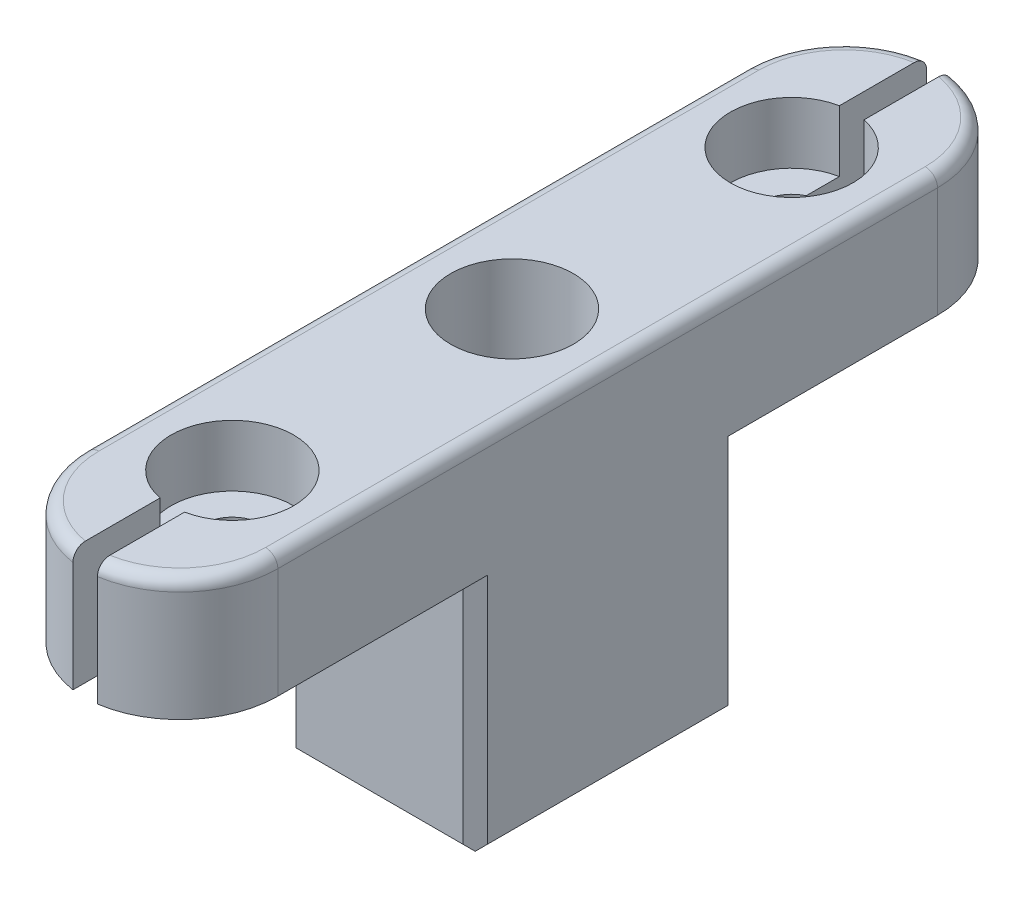
from build123d import *

# Parameters (mm, degrees)
ESQUISSE1_W             = 7.8
ESQUISSE1_H             = 10.8
BOSS_EXTRU_1_DEPTH      = 15
ESQUISSE6_R             = 1.05
ENL_V_MAT_EXTRU_2_DEPTH = 21.061904197
ENL_V_MAT_EXTRU_3_DEPTH = 2
ESQUISSE8_R             = 2.5
ENL_V_MAT_EXTRU_4_DEPTH = 11
ESQUISSE9_W             = 7.8
ESQUISSE9_H             = 5
BOSS_EXTRU_2_DEPTH      = 12
ESQUISSE10_W            = 7.8
ESQUISSE10_H            = 5
BOSS_EXTRU_3_DEPTH      = 12
ESQUISSE11_R            = 1.2
ENL_V_MAT_EXTRU_5_DEPTH = 27.089844768
ESQUISSE15_W            = 1
ESQUISSE15_H            = 4.909128789
ENL_V_MAT_EXTRU_6_DEPTH = 29.384502814
ESQUISSE16_R            = 2.5
ENL_V_MAT_EXTRU_7_DEPTH = 2.5
ESQUISSE17_W            = 1
ESQUISSE17_H            = 4.91
ENL_V_MAT_EXTRU_8_DEPTH = 10
CONG_3_R                = 4
CHANFREIN1_SIZE         = 0.5
CHANFREIN2_SIZE         = 0.5
CONG_5_R                = 0.5


with BuildPart() as part:
    # Esquisse1 → Boss.-Extru.1 (new body)
    with BuildSketch(Plane(origin=(0, 0, 0), x_dir=(1, 0, 0), z_dir=(0, 1, 0))):
        with Locations((3.9, 5.4)):
            Rectangle(ESQUISSE1_W, ESQUISSE1_H)
    extrude(amount=BOSS_EXTRU_1_DEPTH)

    # Esquisse6 → Enlèv. mat.-Extru.2 (cut, through all)
    with BuildSketch(Plane.XZ):
        with Locations(Location((3.9, -5.4, 0), (0, 0, 270))):
            Circle(ESQUISSE6_R)
    extrude(amount=-ENL_V_MAT_EXTRU_2_DEPTH, mode=Mode.SUBTRACT)

    # Esquisse7 → Enlèv. mat.-Extru.3 (cut)
    with BuildSketch(Plane.XZ):
        Polygon((3.9, -7.68), (5.874537921, -6.54), (5.874537921, -4.26), (3.9, -3.12), (1.925462079, -4.26), (1.925462079, -6.54), align=None)
    extrude(amount=-ENL_V_MAT_EXTRU_3_DEPTH, mode=Mode.SUBTRACT)

    # Esquisse8 → Enlèv. mat.-Extru.4 (cut)
    with BuildSketch(Plane(origin=(0, 15, 0), x_dir=(1, 0, 0), z_dir=(0, 1, 0))):
        with Locations(Location((3.9, 5.4, 0), (0, 0, 270))):
            Circle(ESQUISSE8_R)
    extrude(amount=-ENL_V_MAT_EXTRU_4_DEPTH, mode=Mode.SUBTRACT)

    # Esquisse9 → Boss.-Extru.2 (add)
    with BuildSketch(Plane(origin=(0, 0, -10.8), x_dir=(-1, 0, 0), z_dir=(0, 0, -1))):
        with Locations((-3.9, 12.5)):
            Rectangle(ESQUISSE9_W, ESQUISSE9_H)
    extrude(amount=BOSS_EXTRU_2_DEPTH)

    # Esquisse10 → Boss.-Extru.3 (add)
    with BuildSketch(Plane.XY):
        with Locations((3.9, 12.5)):
            Rectangle(ESQUISSE10_W, ESQUISSE10_H)
    extrude(amount=BOSS_EXTRU_3_DEPTH)

    # Esquisse11 → Enlèv. mat.-Extru.5 (cut, through all)
    with BuildSketch(Plane.XZ.offset(-10)):
        with Locations(Location((3.9, -16.8, 0), (0, 0, 270))):
            Circle(ESQUISSE11_R)
        with Locations(Location((3.9, 6, 0), (0, 0, 270))):
            Circle(ESQUISSE11_R)
    extrude(amount=-ENL_V_MAT_EXTRU_5_DEPTH, mode=Mode.SUBTRACT)

    # Esquisse15 → Enlèv. mat.-Extru.6 (cut, through all)
    with BuildSketch(Plane(origin=(0, 15, 0), x_dir=(1, 0, 0), z_dir=(0, 1, 0))):
        with Locations((3.9, -9.545435605)):
            Rectangle(ESQUISSE15_W, ESQUISSE15_H)
    extrude(amount=-ENL_V_MAT_EXTRU_6_DEPTH, mode=Mode.SUBTRACT)

    # Esquisse16 → Enlèv. mat.-Extru.7 (cut)
    with BuildSketch(Plane(origin=(0, 15, 0), x_dir=(1, 0, 0), z_dir=(0, 1, 0))):
        with Locations(Location((3.9, 16.8, 0), (0, 0, 270))):
            Circle(ESQUISSE16_R)
        with Locations((3.9, -6)):
            Circle(ESQUISSE16_R)
    extrude(amount=-ENL_V_MAT_EXTRU_7_DEPTH, mode=Mode.SUBTRACT)

    # Esquisse17 → Enlèv. mat.-Extru.8 (cut)
    with BuildSketch(Plane(origin=(0, 15, 0), x_dir=(1, 0, 0), z_dir=(0, 1, 0))):
        with Locations((3.9, 20.345)):
            Rectangle(ESQUISSE17_W, ESQUISSE17_H)
    extrude(amount=-ENL_V_MAT_EXTRU_8_DEPTH, mode=Mode.SUBTRACT)

    # Congé3
    # the kernel refuses this fillet: 4 mm, written as the material it takes off along each edge
    with BuildSketch(Plane(origin=(7.8, 24.886859967, 12), x_dir=(-1, 0, 0), z_dir=(0, -1, 0)), Plane(origin=(7.8, 0.113140033, -22.8), x_dir=(-1, 0, 0), z_dir=(0, 1, 0))) as cong_3_piece_1:
        with BuildLine():
            CenterArc((4, 3.954743987), CONG_3_R, 180, 81.373073441)
            Line((0, 3.954743987), (-0.08, 3.954743987))
            Line((-0.08, 3.954743987), (-0.08, 0))
            Line((-0.08, 0), (0, -0.08))
            ThreePointArc((0, -0.08), (1.7, -0.08), (3.388, -0.07909488))
            Line((3.388, -0.07909488), (3.4, 0))
        make_face()
    extrude(amount=24.773719933, mode=Mode.SUBTRACT)
    with BuildSketch(Plane(origin=(0, 0.113140033, 12), x_dir=(0, 0, -1), z_dir=(0, 1, 0)), Plane(origin=(0, 24.886859967, -22.8), x_dir=(0, 0, 1), z_dir=(0, -1, 0))) as cong_3_piece_2:
        with BuildLine():
            CenterArc((3.954743987, -4), CONG_3_R, 90, 81.373073441)
            Line((0, -3.4), (-0.07909488, -3.388))
            ThreePointArc((-0.07909488, -3.388), (-0.08, -1.7), (-0.08, 0))
            Line((-0.08, 0), (0, 0.08))
            Line((0, 0.08), (3.954743987, 0.08))
            Line((3.954743987, 0.08), (3.954743987, 0))
        make_face()
    extrude(amount=24.773719933, mode=Mode.SUBTRACT)

    # Chanfrein1
    chanfrein1_edges = [part.edges().sort_by_distance(p)[0] for p in [
        (3.9, 0, -10.8),
        (7.8, 0, -5.4),
        (3.9, 0, 0),
        (0, 0, -5.4),
    ]]
    chamfer(chanfrein1_edges, length=CHANFREIN1_SIZE)

    # Chanfrein2
    chanfrein2_edges = [part.edges().sort_by_distance(p)[0] for p in [
        (0, 5.25, -10.8),
        (7.8, 5.25, -10.8),
        (7.8, 5.25, 0),
        (0, 5.25, 0),
    ]]
    chamfer(chanfrein2_edges, length=CHANFREIN2_SIZE)

    # Congé5
    cong_5_edges = [part.edges().sort_by_distance(p)[0] for p in [
        (0, 15, -5.4),
        (7.8, 15, -5.4),
        (0.966849822, 15, -21.452936975),
        (0.966849822, 15, 10.652936975),
        (6.833150178, 15, -21.452936975),
        (6.833150178, 15, 10.652936975),
    ]]
    fillet(cong_5_edges, radius=CONG_5_R)


solid = part.part
